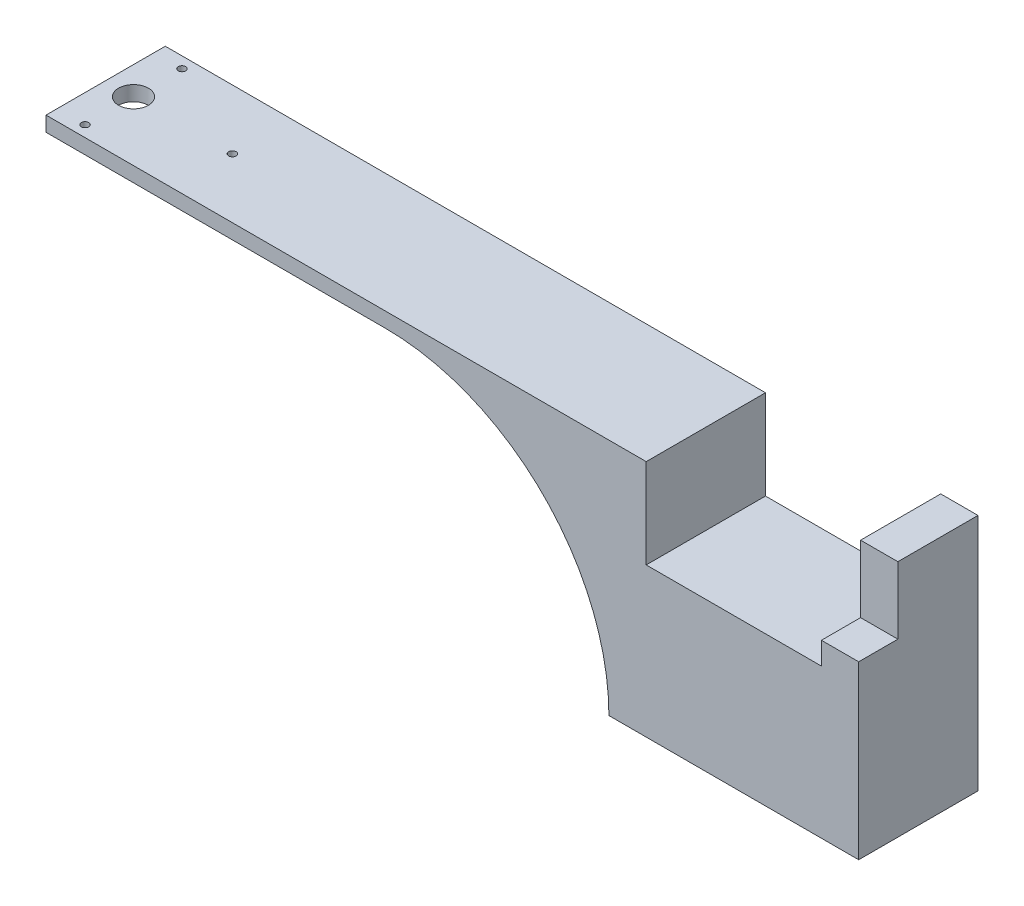
from build123d import *

# Parameters (mm, degrees)
SKETCH1_W           = 33.5
SKETCH1_H           = 16
BOSS_EXTRUDE1_DEPTH = 32
SKETCH2_W           = 23.5
SKETCH2_H           = 16
CUT_EXTRUDE1_DEPTH  = 12
SKETCH4_R           = 0.5
BOSS_EXTRUDE2_DEPTH = 0.5
FILLET1_R           = 0.5
SKETCH6_W           = 16
SKETCH6_H           = 2
BOSS_EXTRUDE3_DEPTH = 75.5
SKETCH7_W           = 5
SKETCH7_H           = 5.252635659
CUT_EXTRUDE2_DEPTH  = 9
SKETCH8_R           = 0.8
CUT_EXTRUDE3_DEPTH  = 8
SKETCH9_R           = 0.5
SKETCH9_R_2         = 2
CUT_EXTRUDE4_DEPTH  = 8
FILLET2_R           = 30


with BuildPart() as part:
    # Sketch1 → Boss-Extrude1 (new body)
    with BuildSketch(Plane(origin=(0, 0, 0), x_dir=(1, 0, 0), z_dir=(0, 1, 0))):
        Rectangle(SKETCH1_W, SKETCH1_H)
    extrude(amount=BOSS_EXTRUDE1_DEPTH)

    # Sketch2 → Cut-Extrude1 (cut)
    with BuildSketch(Plane(origin=(0, 32, 0), x_dir=(1, 0, 0), z_dir=(0, 1, 0))):
        Rectangle(SKETCH2_W, SKETCH2_H)
    extrude(amount=-CUT_EXTRUDE1_DEPTH, mode=Mode.SUBTRACT)

    # Sketch4 → Boss-Extrude2 (add)
    with BuildSketch(Plane(origin=(0, 0, 0), x_dir=(-1, 0, 0), z_dir=(0, -1, 0))):
        with Locations(Location((15.81324072, -7.12248893, 0), (0, 0, 270))):
            Circle(SKETCH4_R)
        with Locations(Location((-15.868829232, -7.12248893, 0), (0, 0, 270))):
            Circle(SKETCH4_R)
        with Locations(Location((-15.868829232, 7.12248893, 0), (0, 0, 270))):
            Circle(SKETCH4_R)
        with Locations(Location((15.81324072, 7.12248893, 0), (0, 0, 270))):
            Circle(SKETCH4_R)
    extrude(amount=BOSS_EXTRUDE2_DEPTH)

    # Fillet1
    fillet1_edges = [part.edges().sort_by_distance(p)[0] for p in [
        (-15.81324072, -0.5, 6.62248893),
        (15.868829232, -0.5, 6.62248893),
        (15.868829232, -0.5, -7.62248893),
        (-15.81324072, -0.5, -7.62248893),
    ]]
    fillet(fillet1_edges, radius=FILLET1_R - 0.0001)  # a hair under: the kernel refuses the full size

    # Sketch6 → Boss-Extrude3 (add)
    with BuildSketch(Plane.ZY.offset(16.75)):
        with Locations((0, 31)):
            Rectangle(SKETCH6_W, SKETCH6_H)
    extrude(amount=BOSS_EXTRUDE3_DEPTH)

    # Sketch7 → Cut-Extrude2 (cut)
    with BuildSketch(Plane(origin=(0, 32, 0), x_dir=(1, 0, 0), z_dir=(0, 1, 0))):
        with Locations((14.25, -5.373682171)):
            Rectangle(SKETCH7_W, SKETCH7_H)
    extrude(amount=-CUT_EXTRUDE2_DEPTH, mode=Mode.SUBTRACT)

    # Sketch8 → Cut-Extrude3 (cut)
    with BuildSketch(Plane.XY):
        with Locations((13.65, 26)):
            Circle(SKETCH8_R)
        with Locations((-13.65, 26)):
            Circle(SKETCH8_R)
    extrude(amount=-CUT_EXTRUDE3_DEPTH, mode=Mode.SUBTRACT)

    # Sketch9 → Cut-Extrude4 (cut)
    with BuildSketch(Plane(origin=(0, 32, 0), x_dir=(1, 0, 0), z_dir=(0, 1, 0))):
        with Locations(Location((-88.515974664, 6.5, 0), (0, 0, 270))):
            Circle(SKETCH9_R)
        with Locations(Location((-75.25, 0, 0), (0, 0, 270))):
            Circle(SKETCH9_R)
        with Locations(Location((-88.515974664, -6.5, 0), (0, 0, 270))):
            Circle(SKETCH9_R)
        with Locations(Location((-88.515974664, 0, 0), (0, 0, 270))):
            Circle(SKETCH9_R_2)
    extrude(amount=-CUT_EXTRUDE4_DEPTH, mode=Mode.SUBTRACT)

    # Fillet2
    fillet2_edges = [part.edges().sort_by_distance(p)[0] for p in [
        (-16.75, 30, 0),
    ]]
    fillet(fillet2_edges, radius=FILLET2_R - 0.0001)  # a hair under: the kernel refuses the full size


solid = part.part
